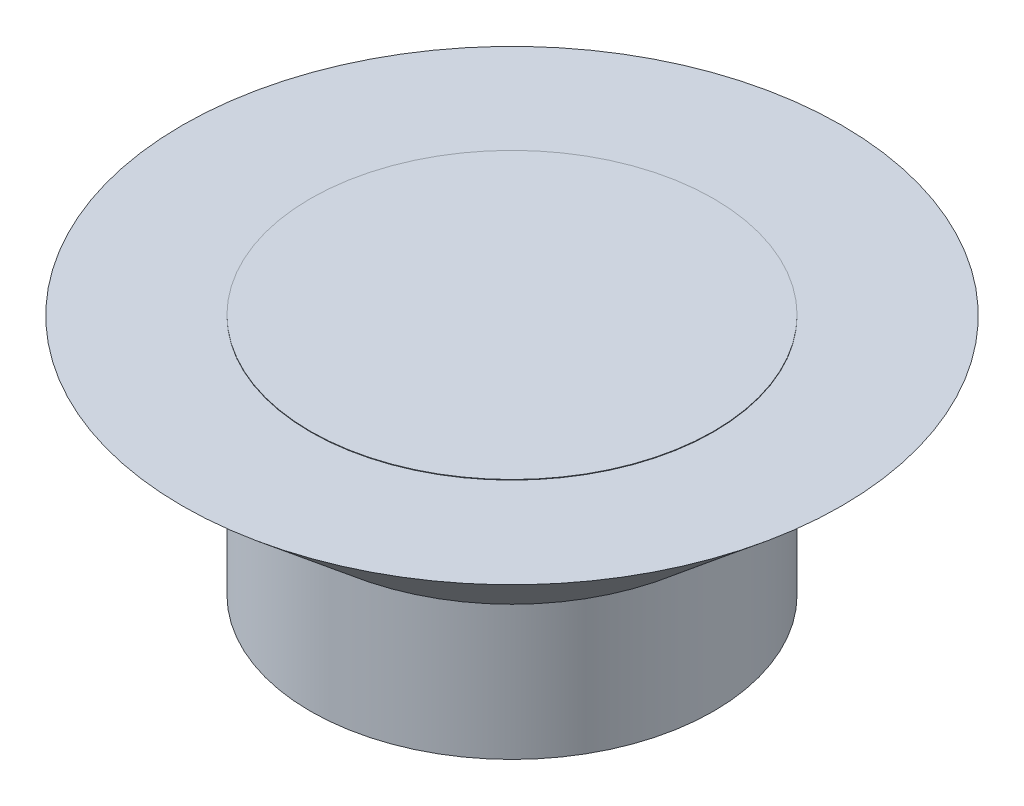
from build123d import *

# Parameters (mm, degrees)
BOSS_EXTRUDE1_START = 0.0254
SKETCH2_R           = 9.525
BOSS_EXTRUDE1_DEPTH = 0.0254


with BuildPart() as part:
    # Sketch1 → Revolve1 (revolve)
    with BuildSketch(Plane.XY):
        Polygon((0, 0), (-9.525, 0), (-9.525, 6.35), (-15.57910825, 11.43), (0, 11.43), align=None)
    revolve(axis=Axis((0, 0, 0), (0, 1, 0)))

    # Sketch2 → Boss-Extrude1 (add)
    with BuildSketch(Plane(origin=(0, 11.43, 0), x_dir=(1, 0, 0), z_dir=(0, 1, 0)).offset(BOSS_EXTRUDE1_START)):
        Circle(SKETCH2_R)
    extrude(amount=-BOSS_EXTRUDE1_DEPTH)


solid = part.part
